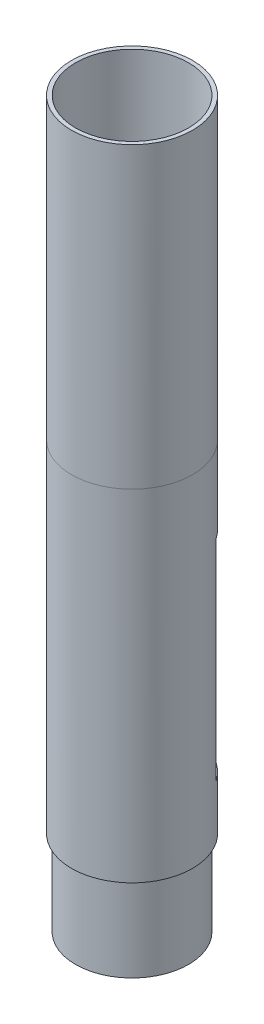
from build123d import *

# Parameters (mm, degrees)
SKETCH1_R               = 28.4
SKETCH1_R_2             = 26.525
BOSS_EXTRUDE1_DEPTH     = 300
SKETCH1_3_R             = 26.525
BOSS_EXTRUDE2_DEPTH     = 130
BOSS_EXTRUDE3_START     = -40
SKETCH1_4_R             = 26.525
SKETCH1_4_R_2           = 25
BOSS_EXTRUDE3_DEPTH     = 40
CUT_EXTRUDE1_DEPTH      = 10
CUT_EXTRUDE1_DEPTH_BACK = 40
CUT_EXTRUDE2_DEPTH      = 175.680050378
CUT_EXTRUDE2_DEPTH_BACK = 175.680050378
SKETCH3_R               = 3.25
CUT_EXTRUDE4_DEPTH      = 175.680050378
CUT_EXTRUDE4_DEPTH_BACK = 175.680050378
SKETCH5_R               = 1.625
CUT_EXTRUDE5_DEPTH      = 6
CUT_EXTRUDE6_REACH      = 303.953
SKETCH10_R              = 1.75
CUT_EXTRUDE7_DEPTH      = 20
CUT_EXTRUDE7_DEPTH_BACK = 20
SKETCH11_R              = 26.925
SKETCH11_R_2            = 26.525
SKETCH12_R              = 26.975
SKETCH12_R_2            = 26.525
BOSS_EXTRUDE4_DEPTH     = 19.5


with BuildPart() as part:
    # Sketch1 → Boss-Extrude1 (new body)
    with BuildSketch(Plane(origin=(0, 0, 0), x_dir=(1, 0, 0), z_dir=(0, 1, 0))):
        Circle(SKETCH1_R)
        Circle(SKETCH1_R_2, mode=Mode.SUBTRACT)
    extrude(amount=BOSS_EXTRUDE1_DEPTH)

    # Sketch1<3> → Boss-Extrude2 (add)
    with BuildSketch(Plane(origin=(0, 0, 0), x_dir=(1, 0, 0), z_dir=(0, 1, 0))):
        Circle(SKETCH1_3_R)
    extrude(amount=BOSS_EXTRUDE2_DEPTH)

    # Sketch1<4> → Boss-Extrude3 (add)
    with BuildSketch(Plane(origin=(0, 0, 0), x_dir=(1, 0, 0), z_dir=(0, 1, 0)).offset(BOSS_EXTRUDE3_START)):
        Circle(SKETCH1_4_R)
        Circle(SKETCH1_4_R_2, mode=Mode.SUBTRACT)
    extrude(amount=BOSS_EXTRUDE3_DEPTH)

    # Sketch2 → Cut-Extrude1 (cut, two sides: drawn at the far end of the back side and taken through both)
    with BuildSketch(Plane.XY.offset(-CUT_EXTRUDE1_DEPTH_BACK)):
        Polygon((-23.385, 25), (23.385, 25), (23.385, 39.125), (23.385, 41.625), (23.385, 106.975), (23.385, 109.475), (23.385, 123.6), (-23.385, 123.6), (-23.385, 109.475), (-23.385, 106.975), (-23.385, 41.625), (-23.385, 39.125), align=None)
    extrude(amount=CUT_EXTRUDE1_DEPTH + CUT_EXTRUDE1_DEPTH_BACK, mode=Mode.SUBTRACT)

    # Sketch3 → Cut-Extrude2 (cut, two sides: drawn at the far end of the back side and taken through both)
    with BuildSketch(Plane(origin=(0, 130, 0), x_dir=(1, 0, 0), z_dir=(0, 1, 0)).offset(-CUT_EXTRUDE2_DEPTH_BACK)):
        with Locations((0, -22.5)):
            Circle(SKETCH3_R)
    extrude(amount=CUT_EXTRUDE2_DEPTH + CUT_EXTRUDE2_DEPTH_BACK, mode=Mode.SUBTRACT)

    # Sketch5 → Cut-Extrude4 (cut, two sides: drawn at the far end of the back side and taken through both)
    with BuildSketch(Plane(origin=(0, 130, 0), x_dir=(1, 0, 0), z_dir=(0, 1, 0)).offset(-CUT_EXTRUDE4_DEPTH_BACK)):
        with Locations((0, 18)):
            Circle(SKETCH5_R)
        Circle(SKETCH5_R)
    extrude(amount=CUT_EXTRUDE4_DEPTH + CUT_EXTRUDE4_DEPTH_BACK, mode=Mode.SUBTRACT)

    # Sketch9 → Cut-Extrude5 (cut)
    with BuildSketch(Plane(origin=(0, 0, 10), x_dir=(-1, 0, 0), z_dir=(0, 0, -1))):
        Polygon((2, 44.3), (17.5, 44.3), (17.5, 104.3), (-17.5, 104.3), (-17.5, 44.3), (-2, 44.3), (-2, 25), (2, 25), align=None)
    extrude(amount=-CUT_EXTRUDE5_DEPTH, mode=Mode.SUBTRACT)

    # Sketch10 → Cut-Extrude6 (cut, up to next)
    with BuildSketch(Plane(origin=(0.8075, 0.8075, 0), x_dir=(0, 0, -1), z_dir=(0.7071067811865488, 0.7071067811865464, 0)), mode=Mode.PRIVATE) as cut_extrude6_sk1:
        with Locations((0, 45.449199077)):
            Circle(SKETCH10_R)
    cut_extrude6_tool1 = extrude(cut_extrude6_sk1.sketch, amount=CUT_EXTRUDE6_REACH, mode=Mode.PRIVATE) & part.part
    add(cut_extrude6_tool1.solids().sort_by_distance((-31.329937, 32.944937, 0))[0], mode=Mode.SUBTRACT)


with BuildPart() as body_2:
    # Split1: the piece on the far side of the plane
    add(part.part)
    split(bisect_by=Plane(origin=(0, 160, 0), x_dir=(0, 0, -1), z_dir=(0, -1, 0)), keep=Keep.BOTTOM)


with BuildPart() as part_1:
    add(part.part)

    # Split1
    split(bisect_by=Plane(origin=(0, 160, 0), x_dir=(0, 0, -1), z_dir=(0, -1, 0)), keep=Keep.TOP)


with BuildPart() as cut_extrude7_tool:
    # Sketch11 → Cut-Extrude7 (new, two sides: drawn at the far end of the back side and taken through both)
    with BuildSketch(Plane(origin=(0, 160, 0), x_dir=(-1, 0, 0), z_dir=(0, -1, 0)).offset(-CUT_EXTRUDE7_DEPTH_BACK)):
        Circle(SKETCH11_R)
        Circle(SKETCH11_R_2, mode=Mode.SUBTRACT)
    extrude(amount=CUT_EXTRUDE7_DEPTH + CUT_EXTRUDE7_DEPTH_BACK)


with BuildPart() as part_2:
    add(part_1.part)

    # Cut-Extrude7: cut by cut_extrude7_tool
    add(cut_extrude7_tool.part, mode=Mode.SUBTRACT)


with BuildPart() as body_2_1:
    add(body_2.part)

    # Cut-Extrude7: cut by cut_extrude7_tool
    add(cut_extrude7_tool.part, mode=Mode.SUBTRACT)


with BuildPart() as body_3:
    # Sketch12 → Boss-Extrude4 (new, symmetric)
    with BuildSketch(Plane(origin=(0, 160, 0), x_dir=(-1, 0, 0), z_dir=(0, -1, 0))):
        Circle(SKETCH12_R)
        Circle(SKETCH12_R_2, mode=Mode.SUBTRACT)
    extrude(amount=BOSS_EXTRUDE4_DEPTH, both=True)


solid = Compound([part_2.part, body_2_1.part, body_3.part])
